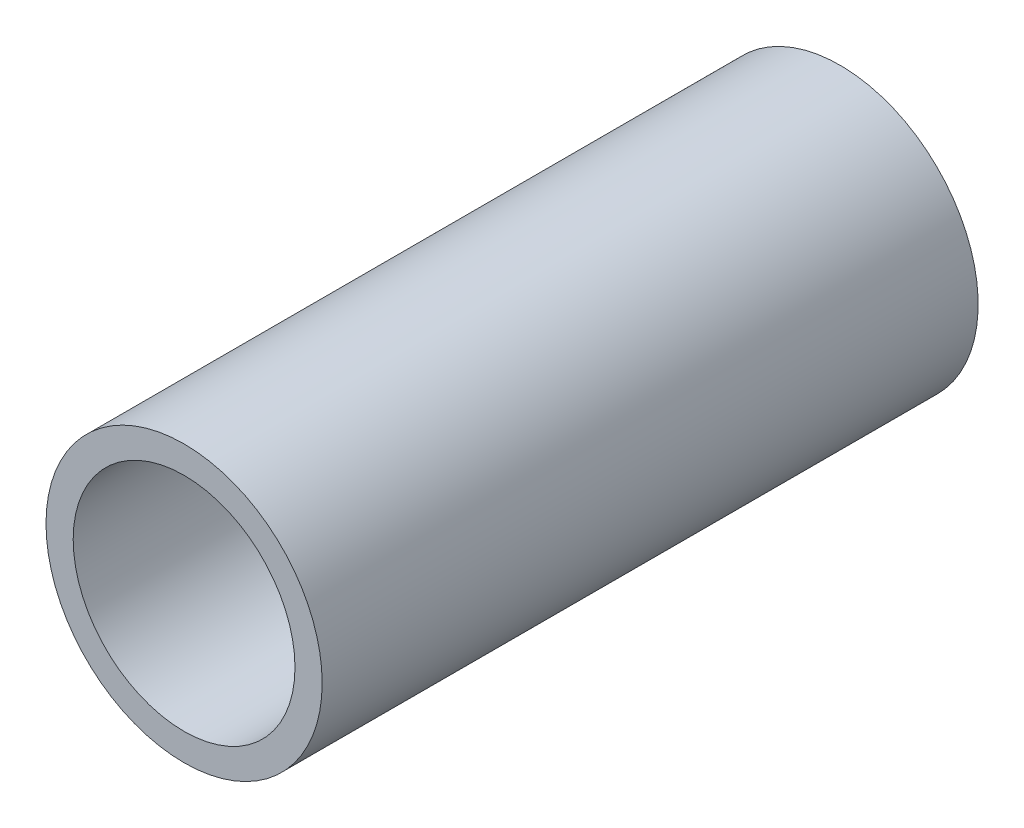
from build123d import *

# Parameters (mm, degrees)
SKETCH1_R           = 9.525
SKETCH1_R_2         = 7.65
BOSS_EXTRUDE1_DEPTH = 44.25
SKETCH2_R           = 8.65
SKETCH2_R_2         = 7.65
CUT_EXTRUDE1_DEPTH  = 0.79
BOSS_EXTRUDE2_START = 1
SKETCH3_R           = 9.525
SKETCH3_R_2         = 8.65
BOSS_EXTRUDE2_DEPTH = 1
THREAD1_PITCH       = 0.25


with BuildPart() as part:
    # Sketch1 → Boss-Extrude1 (new body)
    with BuildSketch(Plane.XY):
        Circle(SKETCH1_R)
        Circle(SKETCH1_R_2, mode=Mode.SUBTRACT)
    extrude(amount=BOSS_EXTRUDE1_DEPTH)

    # Sketch2 → Cut-Extrude1 (cut)
    with BuildSketch(Plane(origin=(0, 0, 0), x_dir=(-1, 0, 0), z_dir=(0, 0, -1))):
        Circle(SKETCH2_R)
        Circle(SKETCH2_R_2, mode=Mode.SUBTRACT)
    extrude(amount=-CUT_EXTRUDE1_DEPTH, mode=Mode.SUBTRACT)

    # Sketch3 → Boss-Extrude2 (add)
    with BuildSketch(Plane(origin=(0, 0, 0), x_dir=(-1, 0, 0), z_dir=(0, 0, -1)).offset(BOSS_EXTRUDE2_START)):
        Circle(SKETCH3_R)
        Circle(SKETCH3_R_2, mode=Mode.SUBTRACT)
    extrude(amount=-BOSS_EXTRUDE2_DEPTH)

    # Thread1: the profile of Thread Profile1 profile screwed along a right-hand helix of 7.2 turns, 6 arcs to a turn; built about Z, then put on its axis
    thread1_z = Axis((0, 0, 0), (0, 0, 1))
    thread1_corners = [(8.6497, 0, -0.000173205), (8.785316469, 0, 0.078125), (8.785316469, 0, 0.109375), (8.6497, 0, 0.187673204)]
    with BuildLine(mode=Mode.PRIVATE) as thread1_profile:
        Line(thread1_corners[0], thread1_corners[1])
        Line(thread1_corners[1], thread1_corners[2])
        Line(thread1_corners[2], thread1_corners[3])
        Line(thread1_corners[3], thread1_corners[0])
    thread1_cap = Face(thread1_profile.wire())
    thread1_turn_angles = [0, 30, 60, 90, 120, 150, 180, 210, 240, 270, 300, 330, 360]
    thread1_turn_weights = [1, 0.8660254037844387, 1, 0.8660254037844387, 1, 0.8660254037844387, 1, 0.8660254037844387, 1, 0.8660254037844387, 1, 0.8660254037844387, 1]
    thread1_turn_rails = [Edge.make_bspline([Vector(p[0], p[1], 0).rotate(thread1_z, thread1_turn_angles[k]) / thread1_turn_weights[k] + Vector(0, 0, p[2] + THREAD1_PITCH * thread1_turn_angles[k] / 360) for k in range(13)], [0, 0, 0, 1, 1, 2, 2, 3, 3, 4, 4, 5, 5, 6, 6, 6], 2, thread1_turn_weights) for p in thread1_corners]
    thread1_turn_sides = [Face.make_surface_from_curves(thread1_turn_rails[p[0]], thread1_turn_rails[p[1]]) for p in [(0, 1), (1, 2), (2, 3), (3, 0)]]
    thread1_last_angles = [2520, 2550, 2580, 2586, 2592]
    thread1_last_weights = [1, 0.8660254037844387, 1, 0.9945218953682733, 1]
    thread1_last_rails = [Edge.make_bspline([Vector(p[0], p[1], 0).rotate(thread1_z, thread1_last_angles[k]) / thread1_last_weights[k] + Vector(0, 0, p[2] + THREAD1_PITCH * thread1_last_angles[k] / 360) for k in range(5)], [0, 0, 0, 1, 1, 2, 2, 2], 2, thread1_last_weights) for p in thread1_corners]
    thread1_last_sides = [Face.make_surface_from_curves(thread1_last_rails[p[0]], thread1_last_rails[p[1]]) for p in [(0, 1), (1, 2), (2, 3), (3, 0)]]
    thread1 = Plane(origin=(0, 0, -1), x_dir=(1, 0, 0), z_dir=(0, 0, 1)) * Solid(Shell([*[p.moved(Location((0, 0, THREAD1_PITCH * i))) for i in range(7) for p in thread1_turn_sides], *thread1_last_sides, thread1_cap, thread1_cap.rotate(thread1_z, 2592).moved(Location((0, 0, THREAD1_PITCH * 2592 / 360)))]))
    add(thread1, mode=Mode.SUBTRACT)


solid = part.part
